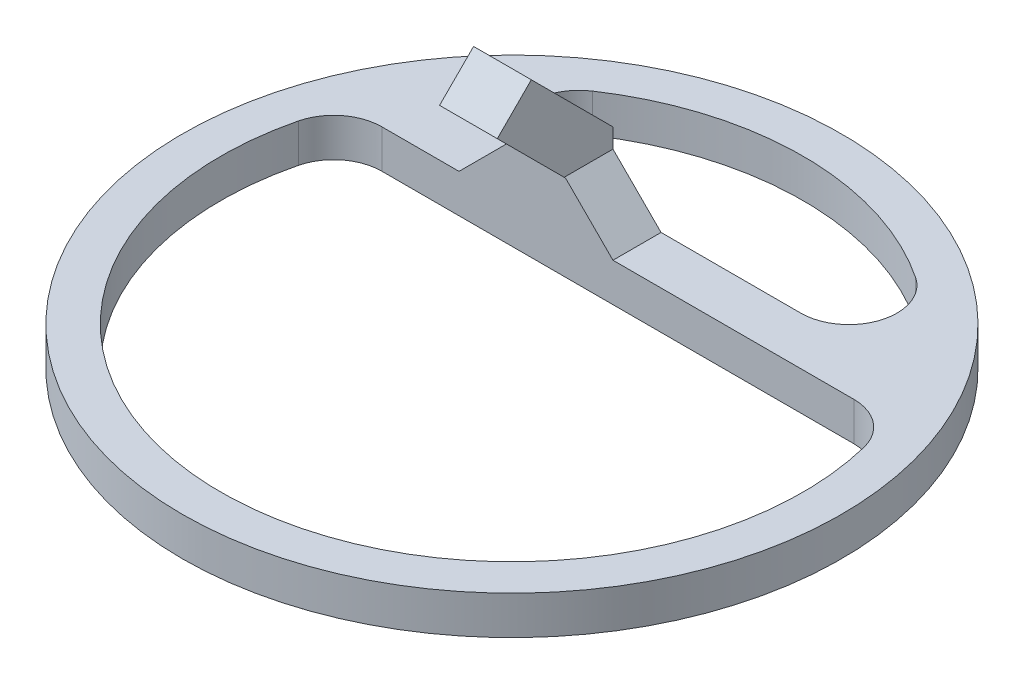
from build123d import *

# Parameters (mm, degrees)
SKETCH1_R           = 34.25
SKETCH1_R_2         = 30.25
BOSS_EXTRUDE1_DEPTH = 4
BOSS_EXTRUDE2_START = -11.5
BOSS_EXTRUDE2_DEPTH = 6
BOSS_EXTRUDE3_START = 4
BOSS_EXTRUDE3_DEPTH = 4
CHAMFER1_SIZE       = 5
FILLET1_R           = 5
CUT_EXTRUDE2_REACH  = 58.809
SKETCH6_R           = 1.65


with BuildPart() as part:
    # Sketch1 → Boss-Extrude1 (new body)
    with BuildSketch(Plane(origin=(0, 0, 0), x_dir=(1, 0, 0), z_dir=(0, 1, 0))):
        with Locations(Location((0, 0, 0), (0, 0, 270))):
            Circle(SKETCH1_R)
        with Locations(Location((0, 0, 0), (0, 0, 270))):
            Circle(SKETCH1_R_2, mode=Mode.SUBTRACT)
    extrude(amount=BOSS_EXTRUDE1_DEPTH)



with BuildPart() as body_2:
    # Sketch2 → Boss-Extrude2 (new body)
    with BuildSketch(Plane(origin=(0, 0, 0), x_dir=(0, 0, -1), z_dir=(1, 0, 0)).offset(BOSS_EXTRUDE2_START)):
        Polygon((3.97918472, 15.949747468), (11, 8.928932188), (11, 4), (16, 4), (16, 11), (7.514718626, 19.485281374), align=None)
    extrude(amount=BOSS_EXTRUDE2_DEPTH)


with BuildPart() as part_1:
    add(part.part)

    add(body_2.part)  # Boss-Extrude3 merges body 2
    # Sketch5 → Boss-Extrude3 (add)
    with BuildSketch(Plane.XZ.offset(-4).offset(BOSS_EXTRUDE3_START)):
        with BuildLine():
            Line((28.179114606, -11), (-28.179114606, -11))
            ThreePointArc((-28.179114606, -11), (-27.041474823, -13.558065475), (-25.672212604, -16))
            Line((-25.672212604, -16), (25.672212604, -16))
            ThreePointArc((25.672212604, -16), (27.041474823, -13.558065475), (28.179114606, -11))
        make_face()
    extrude(amount=-BOSS_EXTRUDE3_DEPTH)

    # Chamfer1
    # the kernel refuses this chamfer: 5 mm, written as the material it adds along each edge
    with BuildSketch(Plane(origin=(-11.5, 4, 1.85841494), x_dir=(-0.9996219169112968, -0.027495876610586403, 0), z_dir=(0, 0, -1))) as chamfer1_piece_1_section:
        Polygon((CHAMFER1_SIZE * 0.999621916911, CHAMFER1_SIZE * 0.0274958766106), (-CHAMFER1_SIZE * 0.0274958766106, CHAMFER1_SIZE * 0.999621916911), (0, 0), align=None)
    chamfer1_piece_1 = extrude(amount=17.85841494, mode=Mode.PRIVATE)
    chamfer1_piece_1 = split(chamfer1_piece_1, bisect_by=Plane(origin=(-11.354428767, 9.056622431, -11), z_dir=(0, 0, 1)), keep=Keep.TOP, mode=Mode.PRIVATE)
    chamfer1_piece_1 = split(chamfer1_piece_1, bisect_by=Plane(origin=(-11.354428767, 9.02469987, -10.904232318), z_dir=(0, 0.7071067811865489, -0.7071067811865462)), keep=Keep.TOP, mode=Mode.PRIVATE)
    add(chamfer1_piece_1)
    with BuildSketch(Plane(origin=(-11.5, 4, -11), x_dir=(-0.9996219169112968, -0.027495876610586924, 0), z_dir=(0, 0, -1))) as chamfer1_piece_2_section:
        Polygon((CHAMFER1_SIZE * 0.999621916911, CHAMFER1_SIZE * 0.0274958766106), (-CHAMFER1_SIZE * 0.0274958766106, CHAMFER1_SIZE * 0.999621916911), (0, 0), align=None)
    chamfer1_piece_2 = extrude(amount=5, mode=Mode.PRIVATE)
    chamfer1_piece_2 = split(chamfer1_piece_2, bisect_by=Plane(origin=(-13.406884942, 6.106803662, -13.822128526), z_dir=(0, -0.7071067811865489, 0.7071067811865462)), keep=Keep.TOP, mode=Mode.PRIVATE)
    add(chamfer1_piece_2)
    with BuildSketch(Plane(origin=(-11.5, 4, -11), x_dir=(-0.9996219169112968, -0.027495876610586924, 0), z_dir=(0, 0, -1))) as chamfer1_piece_3_section:
        Polygon((CHAMFER1_SIZE * 0.999621916911, CHAMFER1_SIZE * 0.0274958766106), (-CHAMFER1_SIZE * 0.0274958766106, CHAMFER1_SIZE * 0.999621916911), (0, 0), align=None)
    chamfer1_piece_3 = extrude(amount=5, mode=Mode.PRIVATE)
    chamfer1_piece_3 = split(chamfer1_piece_3, bisect_by=Plane(origin=(-12.657418843, 5.909631949, -14.019300239), z_dir=(0, 0.7071067811865489, -0.7071067811865462)), keep=Keep.TOP, mode=Mode.PRIVATE)
    add(chamfer1_piece_3)
    with BuildSketch(Plane(origin=(-5.5, 4, 1.85841494), x_dir=(0.9996219169112968, -0.027495876610586403, 0), z_dir=(0, 0, -1))) as chamfer1_piece_4_section:
        Polygon((CHAMFER1_SIZE * 0.999621916911, -CHAMFER1_SIZE * 0.0274958766106), (-CHAMFER1_SIZE * 0.0274958766106, -CHAMFER1_SIZE * 0.999621916911), (0, 0), align=None)
    chamfer1_piece_4 = extrude(amount=17.85841494, mode=Mode.PRIVATE)
    chamfer1_piece_4 = split(chamfer1_piece_4, bisect_by=Plane(origin=(-5.645571233, 9.056622431, -11), z_dir=(0, 0, 1)), keep=Keep.TOP, mode=Mode.PRIVATE)
    chamfer1_piece_4 = split(chamfer1_piece_4, bisect_by=Plane(origin=(-5.645571233, 9.02469987, -10.904232318), z_dir=(0, 0.7071067811865489, -0.7071067811865462)), keep=Keep.TOP, mode=Mode.PRIVATE)
    add(chamfer1_piece_4)
    with BuildSketch(Plane(origin=(-5.5, 4, -11), x_dir=(0.9996219169112968, -0.027495876610586924, 0), z_dir=(0, 0, -1))) as chamfer1_piece_5_section:
        Polygon((CHAMFER1_SIZE * 0.999621916911, -CHAMFER1_SIZE * 0.0274958766106), (-CHAMFER1_SIZE * 0.0274958766106, -CHAMFER1_SIZE * 0.999621916911), (0, 0), align=None)
    chamfer1_piece_5 = extrude(amount=5, mode=Mode.PRIVATE)
    chamfer1_piece_5 = split(chamfer1_piece_5, bisect_by=Plane(origin=(-3.593115058, 6.106803662, -13.822128526), z_dir=(0, -0.7071067811865489, 0.7071067811865462)), keep=Keep.TOP, mode=Mode.PRIVATE)
    add(chamfer1_piece_5)
    with BuildSketch(Plane(origin=(-5.5, 4, -11), x_dir=(0.9996219169112968, -0.027495876610586924, 0), z_dir=(0, 0, -1))) as chamfer1_piece_6_section:
        Polygon((CHAMFER1_SIZE * 0.999621916911, -CHAMFER1_SIZE * 0.0274958766106), (-CHAMFER1_SIZE * 0.0274958766106, -CHAMFER1_SIZE * 0.999621916911), (0, 0), align=None)
    chamfer1_piece_6 = extrude(amount=5, mode=Mode.PRIVATE)
    chamfer1_piece_6 = split(chamfer1_piece_6, bisect_by=Plane(origin=(-4.342581157, 5.909631949, -14.019300239), z_dir=(0, 0.7071067811865489, -0.7071067811865462)), keep=Keep.TOP, mode=Mode.PRIVATE)
    add(chamfer1_piece_6)

    # Fillet1
    fillet1_edges = [part_1.edges().sort_by_distance(p)[0] for p in [
        (-25.672212604, 2, -16),
        (-28.179114606, 2, -11),
        (28.179114606, 2, -11),
        (25.672212604, 2, -16),
    ]]
    fillet(fillet1_edges, radius=FILLET1_R)

    # Sketch6 → Cut-Extrude2 (cut, up to next)
    with BuildSketch(Plane(origin=(0, 9.964466094, -9.964466094), x_dir=(1, 0, 0), z_dir=(0, -0.7071067811865487, 0.7071067811865464)), mode=Mode.PRIVATE) as cut_extrude2_sk1:
        with Locations(Location((-8.5, 4.535533906, 0), (0, 0, 270))):
            Circle(SKETCH6_R)
    cut_extrude2_tool1 = extrude(cut_extrude2_sk1.sketch, amount=-CUT_EXTRUDE2_REACH, mode=Mode.PRIVATE) & part_1.part
    add(cut_extrude2_tool1.solids().sort_by_distance((-8.5, 13.171573, -6.757359))[0], mode=Mode.SUBTRACT)


solid = part_1.part
